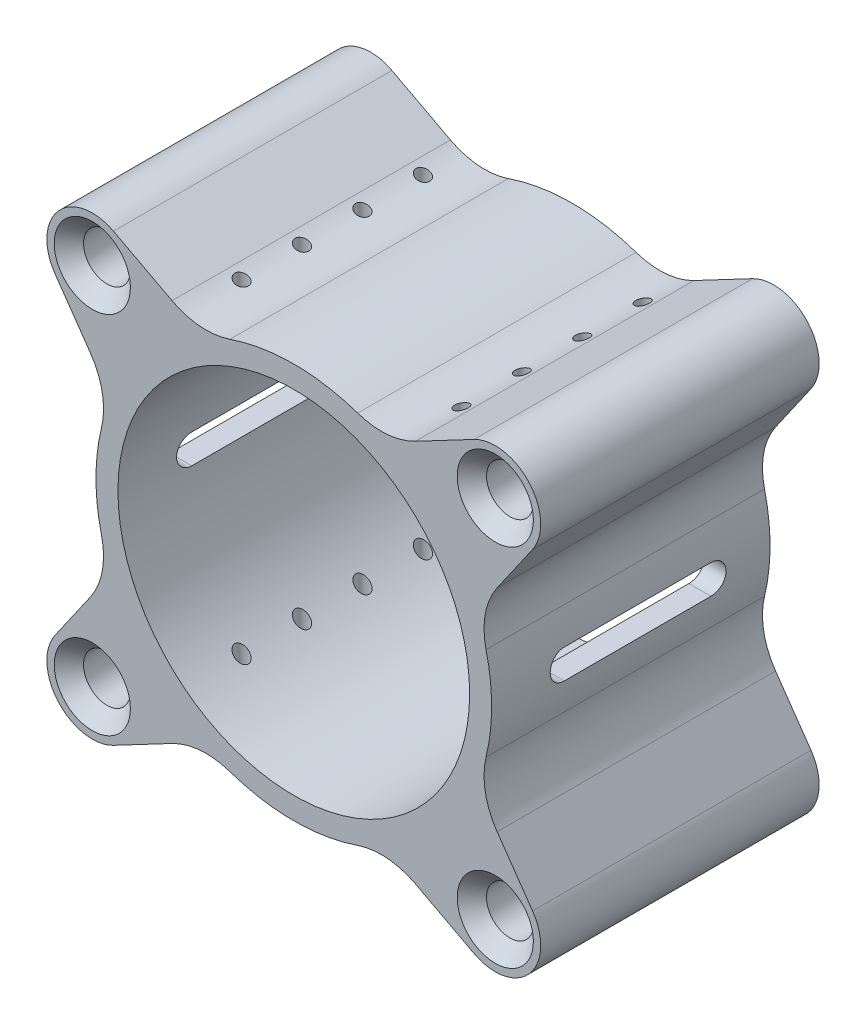
from build123d import *
from OCP.BRepAlgoAPI import BRepAlgoAPI_Cut
from OCP.TopTools import TopTools_ListOfShape

# Parameters (mm, degrees)
SKETCH1_W           = 292.1
SKETCH1_H           = 89.8
SKETCH1_R           = 14.2875
SKETCH1_R_2         = 2.54
SKETCH1_R_3         = 17.145
BOSS_EXTRUDE1_DEPTH = 6.35
SKETCH2_R           = 2.05
CUT_EXTRUDE1_DEPTH  = 10
SKETCH3_R           = 1.55
SKETCH3_R_2         = 2.05
SKETCH3_R_3         = 1.5
CUT_EXTRUDE2_DEPTH  = 10
FILLET1_R           = 2
SKETCH4_R           = 2.05
SKETCH4_R_2         = 1.778
CUT_EXTRUDE4_DEPTH  = 306.657933808
SKETCH5_R           = 3.2
SKETCH5_R_2         = 24
SKETCH5_R_3         = 6.2
BOSS_EXTRUDE2_DEPTH = 38
SKETCH6_W           = 320.608032734
SKETCH6_H           = 6.35
CUT_EXTRUDE5_DEPTH  = 309.793413952
SKETCH7_R           = 0.925
CUT_EXTRUDE7_DEPTH  = 201.132418663
FILLET2_R           = 10
CHAMFER1_SIZE       = 2
CUT_EXTRUDE8_START  = 119.05
CUT_EXTRUDE8_DEPTH  = 53.999999125


with BuildPart() as part:
    # Sketch1 → Boss-Extrude1 (new body)
    with BuildSketch(Plane.XY):
        with Locations((146.05, 44.9)):
            Rectangle(SKETCH1_W, SKETCH1_H)
        with Locations((146.05, 44.9)):
            Circle(SKETCH1_R, mode=Mode.SUBTRACT)
        with Locations((103.051585406, 62.859439014)):
            Circle(SKETCH1_R_2, mode=Mode.SUBTRACT)
        with Locations((103.049439014, 26.938414594)):
            Circle(SKETCH1_R_2, mode=Mode.SUBTRACT)
        with Locations((67.128414594, 26.940560986)):
            Circle(SKETCH1_R_2, mode=Mode.SUBTRACT)
        with Locations((67.130560986, 62.861585406)):
            Circle(SKETCH1_R_2, mode=Mode.SUBTRACT)
        with Locations((85.09, 44.9)):
            Circle(SKETCH1_R_3, mode=Mode.SUBTRACT)
        with Locations((189.050560986, 62.861585406)):
            Circle(SKETCH1_R_2, mode=Mode.SUBTRACT)
        with Locations((224.971585406, 62.859439014)):
            Circle(SKETCH1_R_2, mode=Mode.SUBTRACT)
        with Locations((224.969439014, 26.938414594)):
            Circle(SKETCH1_R_2, mode=Mode.SUBTRACT)
        with Locations((189.048414594, 26.940560986)):
            Circle(SKETCH1_R_2, mode=Mode.SUBTRACT)
        with Locations((207.01, 44.9)):
            Circle(SKETCH1_R_3, mode=Mode.SUBTRACT)
    extrude(amount=BOSS_EXTRUDE1_DEPTH)

    # Sketch2 → Cut-Extrude1 (cut)
    with BuildSketch(Plane.XY.offset(6.35)):
        with Locations((118.55, 20)):
            Circle(SKETCH2_R)
        with Locations(Location((118.55, 69.8, 0), (0, 0, 180))):
            Circle(SKETCH2_R)
        with Locations(Location((173.55, 20, 0), (0, 0, 180))):
            Circle(SKETCH2_R)
        with Locations((173.55, 69.8)):
            Circle(SKETCH2_R)
    extrude(amount=-CUT_EXTRUDE1_DEPTH, mode=Mode.SUBTRACT)

    # Sketch3 → Cut-Extrude2 (cut)
    with BuildSketch(Plane.XY.offset(6.35)):
        with Locations((284.6, 7.5)):
            Circle(SKETCH3_R)
        with Locations(Location((7.5, 7.5, 0), (0, 0, 180))):
            Circle(SKETCH3_R)
        with Locations((7.5, 82.3)):
            Circle(SKETCH3_R)
        with Locations(Location((284.6, 82.3, 0), (0, 0, 180))):
            Circle(SKETCH3_R)
        with Locations((274.6, 20)):
            Circle(SKETCH3_R_2)
        with Locations(Location((17.5, 20, 0), (0, 0, 180))):
            Circle(SKETCH3_R_2)
        with Locations((17.5, 69.8)):
            Circle(SKETCH3_R_2)
        with Locations(Location((274.6, 69.8, 0), (0, 0, 180))):
            Circle(SKETCH3_R_2)
        with Locations((173.55, 7.5)):
            Circle(SKETCH3_R_3)
        with Locations((173.55, 82.3)):
            Circle(SKETCH3_R_3)
        with Locations((118.55, 82.3)):
            Circle(SKETCH3_R_3)
        with Locations((118.55, 7.5)):
            Circle(SKETCH3_R_3)
    extrude(amount=-CUT_EXTRUDE2_DEPTH, mode=Mode.SUBTRACT)

    # Fillet1
    fillet1_edges = [part.edges().sort_by_distance(p)[0] for p in [
        (0, 89.8, 3.175),
        (292.1, 89.8, 3.175),
        (292.1, 0, 3.175),
        (0, 0, 3.175),
    ]]
    fillet(fillet1_edges, radius=FILLET1_R)

    # Sketch4 → Cut-Extrude4 (cut, through all)
    with BuildSketch(Plane.XY.offset(6.35)):
        with Locations((233.55, 20)):
            Circle(SKETCH4_R)
        with Locations((233.55, 69.8)):
            Circle(SKETCH4_R_2)
        with Locations((58.55, 69.8)):
            Circle(SKETCH4_R_2)
        with Locations((58.55, 20)):
            Circle(SKETCH4_R_2)
    extrude(amount=-CUT_EXTRUDE4_DEPTH, mode=Mode.SUBTRACT)

    # Sketch5 → Boss-Extrude2 (add)
    # profile 1 of 3: a face of its own
    with BuildSketch(Plane.XY.offset(6.35)):
        with BuildLine():
            ThreePointArc((158.487656198, 68.864655397), (146.05, 71.9), (133.612343802, 68.864655397))
            Line((133.612343802, 68.864655397), (121.442598426, 75.283874027))
            ThreePointArc((121.442598426, 75.283874027), (113.905359667, 73.90698383), (113.461443019, 66.257883705))
            Line((113.461443019, 66.257883705), (121.116803512, 55.260295021))
            ThreePointArc((121.116803512, 55.260295021), (119.05, 44.9), (121.116803512, 34.539704979))
            Line((121.116803512, 34.539704979), (113.461443019, 23.542116295))
            ThreePointArc((113.461443019, 23.542116295), (113.905359667, 15.89301617), (121.442598426, 14.516125973))
            Line((121.442598426, 14.516125973), (133.612343802, 20.935344603))
            ThreePointArc((133.612343802, 20.935344603), (146.05, 17.9), (158.487656198, 20.935344603))
            Line((158.487656198, 20.935344603), (170.657401574, 14.516125973))
            ThreePointArc((170.657401574, 14.516125973), (168.905359667, 24.10698383), (178.638556981, 23.542116295))
            Line((178.638556981, 23.542116295), (170.983196488, 34.539704979))
            ThreePointArc((170.983196488, 34.539704979), (173.05, 44.9), (170.983196488, 55.260295021))
            ThreePointArc((170.983196488, 55.260295021), (165.935039927, 63.16431458), (158.487656198, 68.864655397))
        make_face()
        with Locations((118.55, 20)):
            Circle(SKETCH5_R, mode=Mode.SUBTRACT)
        with Locations((118.55, 69.8)):
            Circle(SKETCH5_R, mode=Mode.SUBTRACT)
        with Locations((146.05, 44.9)):
            Circle(SKETCH5_R_2, mode=Mode.SUBTRACT)
    # profile 2 of 3: a face of its own
    with BuildSketch(Plane.XY.offset(6.35)):
        with BuildLine():
            Line((170.657401574, 75.283874027), (158.487656198, 68.864655397))
            ThreePointArc((158.487656198, 68.864655397), (165.935039927, 63.16431458), (170.983196488, 55.260295021))
            Line((170.983196488, 55.260295021), (178.638556981, 66.257883705))
            ThreePointArc((178.638556981, 66.257883705), (178.194640333, 73.90698383), (170.657401574, 75.283874027))
        make_face()
        with Locations((173.55, 69.8)):
            Circle(SKETCH5_R, mode=Mode.SUBTRACT)
    # profile 3 of 3: a face of its own
    with BuildSketch(Plane.XY.offset(6.35)):
        with Locations((173.55, 20)):
            Circle(SKETCH5_R_3)
        with Locations((173.55, 20)):
            Circle(SKETCH5_R, mode=Mode.SUBTRACT)
    extrude(amount=BOSS_EXTRUDE2_DEPTH)

    # Sketch6 → Cut-Extrude5 (cut, through all)
    with BuildSketch(Plane(origin=(0, 89.8, 0), x_dir=(1, 0, 0), z_dir=(0, 1, 0))):
        with Locations((145.848635184, -3.175)):
            Rectangle(SKETCH6_W, SKETCH6_H)
    extrude(amount=-CUT_EXTRUDE5_DEPTH, mode=Mode.SUBTRACT)

    # Sketch7 → Cut-Extrude7 (cut, through all)
    with BuildSketch(Plane(origin=(0, 0, 0), x_dir=(1, 0, 0), z_dir=(0, 1, 0))):
        with Locations(Location((161.05, -11.725, 0), (0, 0, 90))):
            Circle(SKETCH7_R)
        with Locations(Location((161.05, -19.975, 0), (0, 0, 90))):
            Circle(SKETCH7_R)
        with Locations(Location((161.05, -28.225, 0), (0, 0, 90))):
            Circle(SKETCH7_R)
        with Locations(Location((161.05, -36.475, 0), (0, 0, 90))):
            Circle(SKETCH7_R)
        with Locations(Location((131.05, -36.475, 0), (0, 0, 90))):
            Circle(SKETCH7_R)
        with Locations(Location((131.05, -28.225, 0), (0, 0, 90))):
            Circle(SKETCH7_R)
        with Locations(Location((131.05, -19.975, 0), (0, 0, 90))):
            Circle(SKETCH7_R)
        with Locations(Location((131.05, -11.725, 0), (0, 0, 90))):
            Circle(SKETCH7_R)
    extrude(amount=CUT_EXTRUDE7_DEPTH, mode=Mode.SUBTRACT)

    # Fillet2
    # the kernel refuses this fillet: 10 mm, written as the material it adds along each edge
    with BuildSketch(Plane(origin=(121.116803512, 55.260295021, 6.35), x_dir=(-0.3103874133456738, -0.9506101480820525, 0), z_dir=(0, 0, 1))) as fillet2_piece_1:
        with BuildLine():
            CenterArc((5.000654742, -9.969427696), FILLET2_R, 94.481386739, 48.442755032)
            Line((-2.977725475, -3.940709001), (0, 0))
            ThreePointArc((0, 0), (2.109651219, -0.082545222), (4.219302439, 0))
        make_face()
    extrude(amount=38)
    with BuildSketch(Plane(origin=(121.116803512, 34.539704979, 6.35), x_dir=(-0.571309079849458, -0.8207349969884101, 0), z_dir=(0, 0, 1)), Plane(origin=(170.983196488, 55.260295021, 6.35), x_dir=(0.5713090798494619, 0.8207349969884075, 0), z_dir=(0, 0, 1))) as fillet2_piece_2:
        with BuildLine():
            CenterArc((4.939234397, -10), FILLET2_R, 90, 48.442755032)
            ThreePointArc((-2.543698749, -3.366319911), (-1.205991658, -1.732924148), (0, 0))
            Line((0, 0), (4.939234397, 0))
        make_face()
    extrude(amount=38)
    with BuildSketch(Plane(origin=(133.612343802, 20.935344603, 6.35), x_dir=(0.9195498478391192, -0.39297337993692766, 0), z_dir=(0, 0, 1))) as fillet2_piece_3_section:
        with BuildLine():
            CenterArc((4.787136553, -9.971986303), FILLET2_R, 94.28967391, 46.660425518)
            Line((-2.978839179, -3.672016389), (0, 0))
            ThreePointArc((0, 0), (2.019573233, -0.075636981), (4.039146467, 0))
        make_face()
    fillet2_piece_3 = extrude(amount=38, mode=Mode.PRIVATE)
    fillet2_piece_3 = fillet2_piece_3 - Plane(origin=(131.05, 20.935344603, 36.475), x_dir=(0, 0, -1), z_dir=(0, -1, 0)) * Cylinder(0.925, 93, mode=Mode.PRIVATE)
    fillet2_piece_3 = fillet2_piece_3 - Plane(origin=(131.05, 20.935344603, 28.225), x_dir=(0, 0, -1), z_dir=(0, -1, 0)) * Cylinder(0.925, 93, mode=Mode.PRIVATE)
    fillet2_piece_3 = fillet2_piece_3 - Plane(origin=(131.05, 20.935344603, 19.975), x_dir=(0, 0, -1), z_dir=(0, -1, 0)) * Cylinder(0.925, 93, mode=Mode.PRIVATE)
    fillet2_piece_3 = fillet2_piece_3 - Plane(origin=(131.05, 20.935344603, 11.725), x_dir=(0, 0, -1), z_dir=(0, -1, 0)) * Cylinder(0.925, 93, mode=Mode.PRIVATE)
    add(fillet2_piece_3)
    with BuildSketch(Plane(origin=(158.487656198, 20.935344603, 6.35), x_dir=(0.8844958108424843, -0.46654813321038596, 0), z_dir=(0, 0, 1))) as fillet2_piece_4_section:
        with BuildLine():
            CenterArc((4.728338737, -10), FILLET2_R, 90, 46.660425518)
            ThreePointArc((-2.544650122, -3.136791344), (-1.213585565, -1.616046743), (0, 0))
            Line((0, 0), (4.728338737, 0))
        make_face()
    fillet2_piece_4 = extrude(amount=38, mode=Mode.PRIVATE)
    fillet2_piece_4 = fillet2_piece_4 - Plane(origin=(161.05, 20.935344603, 36.475), x_dir=(0, 0, -1), z_dir=(0, -1, 0)) * Cylinder(0.925, 95, mode=Mode.PRIVATE)
    fillet2_piece_4 = fillet2_piece_4 - Plane(origin=(161.05, 20.935344603, 28.225), x_dir=(0, 0, -1), z_dir=(0, -1, 0)) * Cylinder(0.925, 95, mode=Mode.PRIVATE)
    fillet2_piece_4 = fillet2_piece_4 - Plane(origin=(161.05, 20.935344603, 19.975), x_dir=(0, 0, -1), z_dir=(0, -1, 0)) * Cylinder(0.925, 95, mode=Mode.PRIVATE)
    fillet2_piece_4 = fillet2_piece_4 - Plane(origin=(161.05, 20.935344603, 11.725), x_dir=(0, 0, -1), z_dir=(0, -1, 0)) * Cylinder(0.925, 95, mode=Mode.PRIVATE)
    add(fillet2_piece_4)
    with BuildSketch(Plane(origin=(170.983196488, 34.539704979, 6.35), x_dir=(0.5713090798494577, -0.8207349969884103, 0), z_dir=(0, 0, 1))) as fillet2_piece_5:
        with BuildLine():
            CenterArc((4.939234397, 10), FILLET2_R, 221.557244968, 48.442755032)
            ThreePointArc((-2.543698749, 3.366319911), (-1.205991658, 1.732924148), (0, 0))
            Line((0, 0), (4.939234397, 0))
        make_face()
    extrude(amount=38)
    with BuildSketch(Plane(origin=(158.487656198, 68.864655397, 6.35), x_dir=(-0.9195498478391212, 0.3929733799369225, 0), z_dir=(0, 0, 1))) as fillet2_piece_6_section:
        with BuildLine():
            CenterArc((4.787136553, -9.971986303), FILLET2_R, 94.28967391, 46.660425518)
            Line((-2.978839179, -3.672016389), (0, 0))
            ThreePointArc((0, 0), (2.019573233, -0.075636981), (4.039146467, 0))
        make_face()
    fillet2_piece_6 = extrude(amount=38, mode=Mode.PRIVATE)
    fillet2_piece_6 = fillet2_piece_6 - Plane(origin=(161.05, 68.864655397, 36.475), x_dir=(0, 0, -1), z_dir=(0, -1, 0)) * Cylinder(0.925, 93, mode=Mode.PRIVATE)
    fillet2_piece_6 = fillet2_piece_6 - Plane(origin=(161.05, 68.864655397, 28.225), x_dir=(0, 0, -1), z_dir=(0, -1, 0)) * Cylinder(0.925, 93, mode=Mode.PRIVATE)
    fillet2_piece_6 = fillet2_piece_6 - Plane(origin=(161.05, 68.864655397, 19.975), x_dir=(0, 0, -1), z_dir=(0, -1, 0)) * Cylinder(0.925, 93, mode=Mode.PRIVATE)
    fillet2_piece_6 = fillet2_piece_6 - Plane(origin=(161.05, 68.864655397, 11.725), x_dir=(0, 0, -1), z_dir=(0, -1, 0)) * Cylinder(0.925, 93, mode=Mode.PRIVATE)
    add(fillet2_piece_6)
    with BuildSketch(Plane(origin=(133.612343802, 68.864655397, 6.35), x_dir=(-0.8844958108424825, 0.46654813321038935, 0), z_dir=(0, 0, 1))) as fillet2_piece_7_section:
        with BuildLine():
            CenterArc((4.728338737, -10), FILLET2_R, 90, 46.660425518)
            ThreePointArc((-2.544650122, -3.136791344), (-1.213585565, -1.616046743), (0, 0))
            Line((0, 0), (4.728338737, 0))
        make_face()
    fillet2_piece_7 = extrude(amount=38, mode=Mode.PRIVATE)
    fillet2_piece_7 = fillet2_piece_7 - Plane(origin=(131.05, 68.864655397, 36.475), x_dir=(0, 0, -1), z_dir=(0, -1, 0)) * Cylinder(0.925, 95, mode=Mode.PRIVATE)
    fillet2_piece_7 = fillet2_piece_7 - Plane(origin=(131.05, 68.864655397, 28.225), x_dir=(0, 0, -1), z_dir=(0, -1, 0)) * Cylinder(0.925, 95, mode=Mode.PRIVATE)
    fillet2_piece_7 = fillet2_piece_7 - Plane(origin=(131.05, 68.864655397, 19.975), x_dir=(0, 0, -1), z_dir=(0, -1, 0)) * Cylinder(0.925, 95, mode=Mode.PRIVATE)
    fillet2_piece_7 = fillet2_piece_7 - Plane(origin=(131.05, 68.864655397, 11.725), x_dir=(0, 0, -1), z_dir=(0, -1, 0)) * Cylinder(0.925, 95, mode=Mode.PRIVATE)
    add(fillet2_piece_7)

    # Chamfer1
    chamfer1_edges = [part.edges().sort_by_distance(p)[0] for p in [
        (170.35, 69.8, 44.35),
        (115.35, 69.8, 44.35),
        (115.35, 20, 44.35),
        (170.35, 20, 44.35),
    ]]
    chamfer(chamfer1_edges, length=CHAMFER1_SIZE)


with BuildPart() as cut_extrude8_tool:
    # Cut-Extrude8: read off the stored shape, not the designer's step
    # Cut-Extrude8 outline → Cut-Extrude8 (new body)
    with BuildSketch(Plane.YZ.offset(CUT_EXTRUDE8_START)):
        with BuildLine():
            Line((46.9, 14.35), (46.9, 34.35))
            ThreePointArc((46.9, 34.35), (44.9, 36.35), (42.9, 34.35))
            Line((42.9, 34.35), (42.9, 14.35))
            ThreePointArc((42.9, 14.35), (44.9, 12.35), (46.9, 14.35))
        make_face()
    extrude(amount=CUT_EXTRUDE8_DEPTH)


with BuildPart() as part_1:
    add(part.part)

    # Cut-Extrude8: cut by cut_extrude8_tool, with a tolerance
    cut_extrude8_stock = TopTools_ListOfShape()
    cut_extrude8_stock.Append(part_1.part.wrapped)
    cut_extrude8_tools = TopTools_ListOfShape()
    cut_extrude8_tools.Append(cut_extrude8_tool.part.wrapped)
    cut_extrude8_cut = BRepAlgoAPI_Cut()
    cut_extrude8_cut.SetArguments(cut_extrude8_stock)
    cut_extrude8_cut.SetTools(cut_extrude8_tools)
    cut_extrude8_cut.SetFuzzyValue(0.00001)
    cut_extrude8_cut.Build()
    add(Compound.cast(cut_extrude8_cut.Shape()).solids(), mode=Mode.REPLACE)


solid = part_1.part
